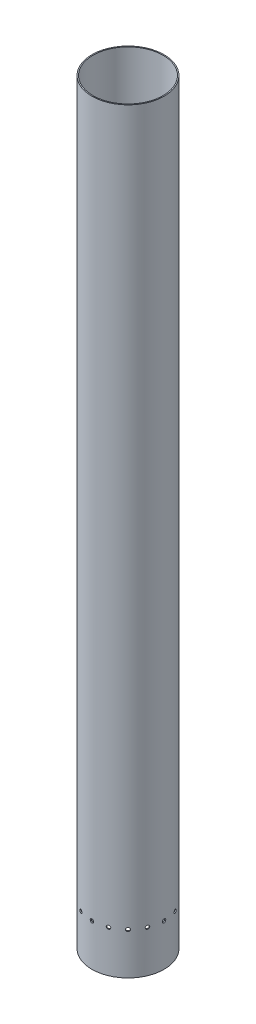
from build123d import *

# Parameters (mm, degrees)
SKETCH1_R           = 65.405
SKETCH1_R_2         = 63.5
BOSS_EXTRUDE1_DEPTH = 1371.6
CUT_EXTRUDE1_REACH  = 1381.375
SKETCH2_R           = 3.175
CIRPATTERN1_COUNT   = 16


with BuildPart() as part:
    # Sketch1 → Boss-Extrude1 (new body)
    with BuildSketch(Plane(origin=(0, 0, 0), x_dir=(1, 0, 0), z_dir=(0, 1, 0))):
        Circle(SKETCH1_R)
        Circle(SKETCH1_R_2, mode=Mode.SUBTRACT)
    extrude(amount=-BOSS_EXTRUDE1_DEPTH)

    # Sketch2 → Cut-Extrude1 (cut, up to next)
    with BuildSketch(Plane.XY.offset(65.405), mode=Mode.PRIVATE) as cut_extrude1_sk1:
        with Locations((0, -1295.4)):
            Circle(SKETCH2_R)
    cut_extrude1_tool1 = extrude(cut_extrude1_sk1.sketch, amount=-CUT_EXTRUDE1_REACH, mode=Mode.PRIVATE) & part.part
    cut_extrude1 = cut_extrude1_tool1.solids().sort_by_distance((0, -1295.4, 65.405))[0]
    add(cut_extrude1, mode=Mode.SUBTRACT)

    # CirPattern1: Cut-Extrude1 ×16 about axis
    cirpattern1_axis = Axis((0, -1371.6, 0), (0, 1, 0))
    for i in range(1, CIRPATTERN1_COUNT):
        add(cut_extrude1.rotate(cirpattern1_axis, i * 360 / CIRPATTERN1_COUNT), mode=Mode.SUBTRACT)


solid = part.part
